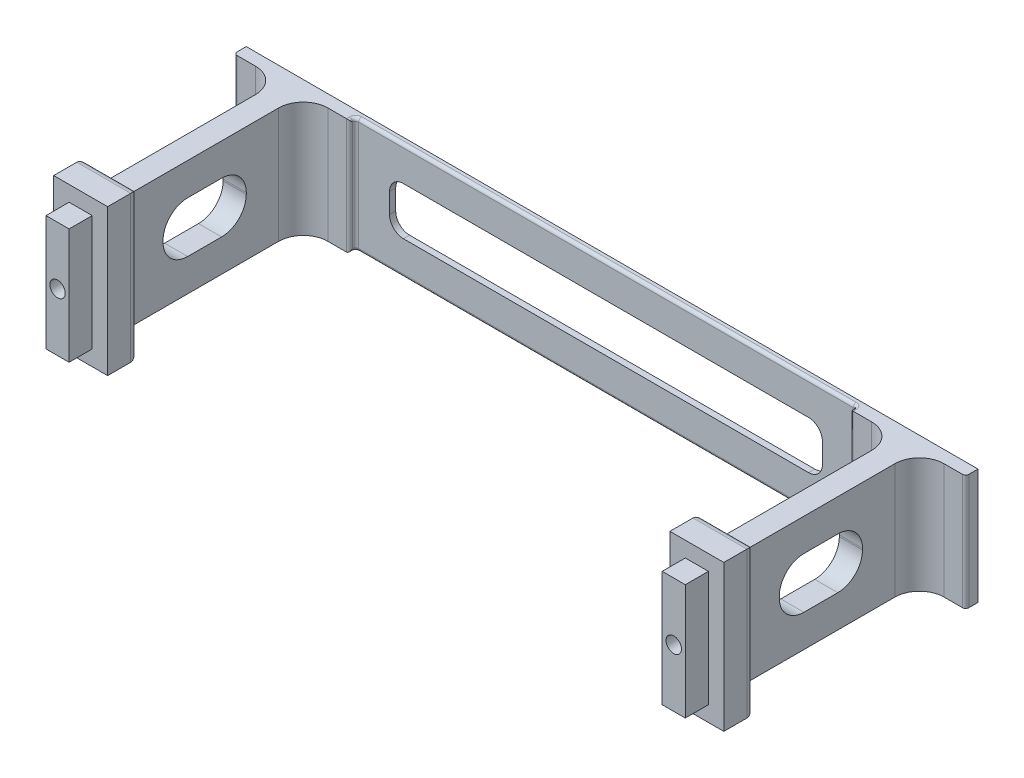
from build123d import *

# Parameters (mm, degrees)
SKETCH1_W           = 65
SKETCH1_H           = 15
BOSS_EXTRUDE1_DEPTH = 0.8
SKETCH1_3_W         = 6
SKETCH1_3_H         = 15
BOSS_EXTRUDE2_DEPTH = 1.6
BOSS_EXTRUDE3_DEPTH = 29
SKETCH2_W           = 7
SKETCH2_H           = 19
SKETCH2_W_2         = 3
SKETCH2_H_2         = 15
BOSS_EXTRUDE4_DEPTH = 4
SKETCH2_2_W         = 3
SKETCH2_2_H         = 15
BOSS_EXTRUDE5_DEPTH = 3
SKETCH3_R           = 1
CUT_EXTRUDE1_DEPTH  = 4.6
FILLET1_R           = 3.2
FILLET2_R           = 0.4
FILLET3_R           = 1
SKETCH4_W           = 56.2
SKETCH4_H           = 6.2
CUT_EXTRUDE2_DEPTH  = 64.705737631
FILLET4_R           = 1.8
SKETCH5_W           = 10.8
SKETCH5_H           = 6.6
CUT_EXTRUDE3_DEPTH  = 98.437864541
FILLET5_R           = 3.2


with BuildPart() as part:
    # Sketch1 → Boss-Extrude1 (new body)
    with BuildSketch(Plane.XY):
        with Locations((2.857159974, 13.933681879)):
            Rectangle(SKETCH1_W, SKETCH1_H)
    extrude(amount=BOSS_EXTRUDE1_DEPTH)

    # Sketch1<3> → Boss-Extrude2 (add)
    with BuildSketch(Plane.XY):
        with Locations((-32.642840026, 13.933681879)):
            Rectangle(SKETCH1_3_W, SKETCH1_3_H)
        with Locations((-41.642840026, 13.933681879)):
            Rectangle(SKETCH1_3_W, SKETCH1_3_H)
        with Locations((38.357159974, 13.933681879)):
            Rectangle(SKETCH1_3_W, SKETCH1_3_H)
        with Locations((47.357159974, 13.933681879)):
            Rectangle(SKETCH1_3_W, SKETCH1_3_H)
    extrude(amount=BOSS_EXTRUDE2_DEPTH)


with BuildPart() as boss_extrude2_piece_1:
    # of the separate pieces the step leaves, piece 1, a body of its own (boss_extrude2_pieces)
    add(part.part.solids().sort_by_distance((41.357159974, 21.433681879, 0))[0])



with BuildPart() as boss_extrude2_piece_2:
    # of the separate pieces the step leaves, piece 2, a body of its own (boss_extrude2_pieces)
    add(part.part.solids().sort_by_distance((50.357159974, 6.433681879, 0))[0])


with BuildPart() as boss_extrude2_piece_3:
    # of the separate pieces the step leaves, piece 3, a body of its own (boss_extrude2_pieces)
    add(part.part.solids().sort_by_distance((-38.642840026, 6.433681879, 0))[0])


with BuildPart() as boss_extrude2_piece_1_1:
    add(boss_extrude2_piece_1.part)

    add(boss_extrude2_piece_2.part)  # Boss-Extrude3 merges Boss-Extrude2 piece 2

    add(boss_extrude2_piece_3.part)  # Boss-Extrude3 merges Boss-Extrude2 piece 3
    # Sketch1<4> → Boss-Extrude3 (add)
    with BuildSketch(Plane.XY):
        Polygon((-35.642840026, 6.433681879), (-35.642840026, 21.433681879), (-37.142840026, 21.433681879), (-38.642840026, 21.433681879), (-38.642840026, 6.433681879), (-37.142840026, 6.433681879), align=None)
        Polygon((42.857159974, 21.433681879), (41.357159974, 21.433681879), (41.357159974, 6.433681879), (42.857159974, 6.433681879), (44.357159974, 6.433681879), (44.357159974, 21.433681879), align=None)
    extrude(amount=BOSS_EXTRUDE3_DEPTH)

    # Sketch2 → Boss-Extrude4 (add)
    # profile 1 of 2: a face of its own
    with BuildSketch(Plane.XY.offset(29)):
        with Locations((-37.142840026, 13.933681879)):
            Rectangle(SKETCH2_W, SKETCH2_H)
        with Locations((-37.142840026, 13.933681879)):
            Rectangle(SKETCH2_W_2, SKETCH2_H_2, mode=Mode.SUBTRACT)
    # profile 2 of 2: a face of its own
    with BuildSketch(Plane.XY.offset(29)):
        with Locations((42.857159974, 13.933681879)):
            Rectangle(SKETCH2_W, SKETCH2_H)
        with Locations((42.857159974, 13.933681879)):
            Rectangle(SKETCH2_W_2, SKETCH2_H_2, mode=Mode.SUBTRACT)
    extrude(amount=-BOSS_EXTRUDE4_DEPTH)

    # Sketch2<2> → Boss-Extrude5 (add)
    with BuildSketch(Plane.XY.offset(29)):
        with Locations((-37.142840026, 13.933681879)):
            Rectangle(SKETCH2_2_W, SKETCH2_2_H)
        with Locations((42.857159974, 13.933681879)):
            Rectangle(SKETCH2_2_W, SKETCH2_2_H)
    extrude(amount=BOSS_EXTRUDE5_DEPTH)

    # Sketch3 → Cut-Extrude1 (cut)
    with BuildSketch(Plane.XY.offset(32)):
        with Locations((-37.142840026, 13.933681879)):
            Circle(SKETCH3_R)
        with Locations((42.857159974, 13.933681879)):
            Circle(SKETCH3_R)
    extrude(amount=-CUT_EXTRUDE1_DEPTH, mode=Mode.SUBTRACT)

    # Fillet1
    fillet1_edges = [boss_extrude2_piece_1_1.edges().sort_by_distance(p)[0] for p in [
        (44.357159974, 13.933681879, 1.6),
        (41.357159974, 13.933681879, 1.6),
        (-35.642840026, 13.933681879, 1.6),
        (-38.642840026, 13.933681879, 1.6),
    ]]
    fillet(fillet1_edges, radius=FILLET1_R)

    # Fillet2
    fillet2_edges = [boss_extrude2_piece_1_1.edges().sort_by_distance(p)[0] for p in [
        (-29.642840026, 21.433681879, 1.2),
        (35.357159974, 21.433681879, 1.2),
        (-29.642840026, 6.433681879, 1.2),
        (35.357159974, 6.433681879, 1.2),
        (2.857159974, 21.433681879, 0.8),
        (2.857159974, 6.433681879, 0.8),
        (50.357159974, 13.933681879, 1.6),
        (35.357159974, 13.933681879, 0.8),
        (35.357159974, 13.933681879, 1.6),
        (-29.642840026, 13.933681879, 0.8),
        (-29.642840026, 13.933681879, 1.6),
        (-44.642840026, 13.933681879, 1.6),
    ]]
    fillet(fillet2_edges, radius=FILLET2_R - 0.0001)  # a hair under: the kernel refuses the full size

    # Fillet3
    fillet3_edges = [boss_extrude2_piece_1_1.edges().sort_by_distance(p)[0] for p in [
        (-37.142840026, 23.433681879, 25),
        (-40.642840026, 13.933681879, 25),
        (-33.642840026, 13.933681879, 25),
        (-37.142840026, 4.433681879, 25),
        (42.857159974, 23.433681879, 25),
        (39.357159974, 13.933681879, 25),
        (42.857159974, 4.433681879, 25),
        (46.357159974, 13.933681879, 25),
        (42.857159974, 6.433681879, 25),
        (41.357159974, 13.933681879, 25),
        (42.857159974, 21.433681879, 25),
        (44.357159974, 13.933681879, 25),
        (-37.142840026, 21.433681879, 25),
        (-35.642840026, 13.933681879, 25),
        (-37.142840026, 6.433681879, 25),
        (-38.642840026, 13.933681879, 25),
    ]]
    fillet(fillet3_edges, radius=FILLET3_R - 0.0001)  # a hair under: the kernel refuses the full size

    # Sketch4 → Cut-Extrude2 (cut, through all)
    with BuildSketch(Plane.XY.offset(0.8)):
        with Locations((2.857159974, 13.933681879)):
            Rectangle(SKETCH4_W, SKETCH4_H)
    extrude(amount=-CUT_EXTRUDE2_DEPTH, mode=Mode.SUBTRACT)

    # Fillet4
    fillet4_edges = [boss_extrude2_piece_1_1.edges().sort_by_distance(p)[0] for p in [
        (30.957159974, 10.833681879, 0.4),
        (-25.242840026, 10.833681879, 0.4),
        (-25.242840026, 17.033681879, 0.4),
        (30.957159974, 17.033681879, 0.4),
    ]]
    fillet(fillet4_edges, radius=FILLET4_R)

    # Sketch5 → Cut-Extrude3 (cut, through all)
    with BuildSketch(Plane(origin=(44.357159974, 0, 0), x_dir=(0, 0, -1), z_dir=(1, 0, 0))):
        with Locations((-14.4, 13.933681879)):
            Rectangle(SKETCH5_W, SKETCH5_H)
    extrude(amount=-CUT_EXTRUDE3_DEPTH, mode=Mode.SUBTRACT)

    # Fillet5
    fillet5_edges = [boss_extrude2_piece_1_1.edges().sort_by_distance(p)[0] for p in [
        (-37.142840026, 17.233681879, 9),
        (42.857159974, 17.233681879, 9),
        (-37.142840026, 10.633681879, 9),
        (42.857159974, 10.633681879, 9),
        (-37.142840026, 10.633681879, 19.8),
        (42.857159974, 10.633681879, 19.8),
        (-37.142840026, 17.233681879, 19.8),
        (42.857159974, 17.233681879, 19.8),
    ]]
    fillet(fillet5_edges, radius=FILLET5_R)


solid = boss_extrude2_piece_1_1.part
